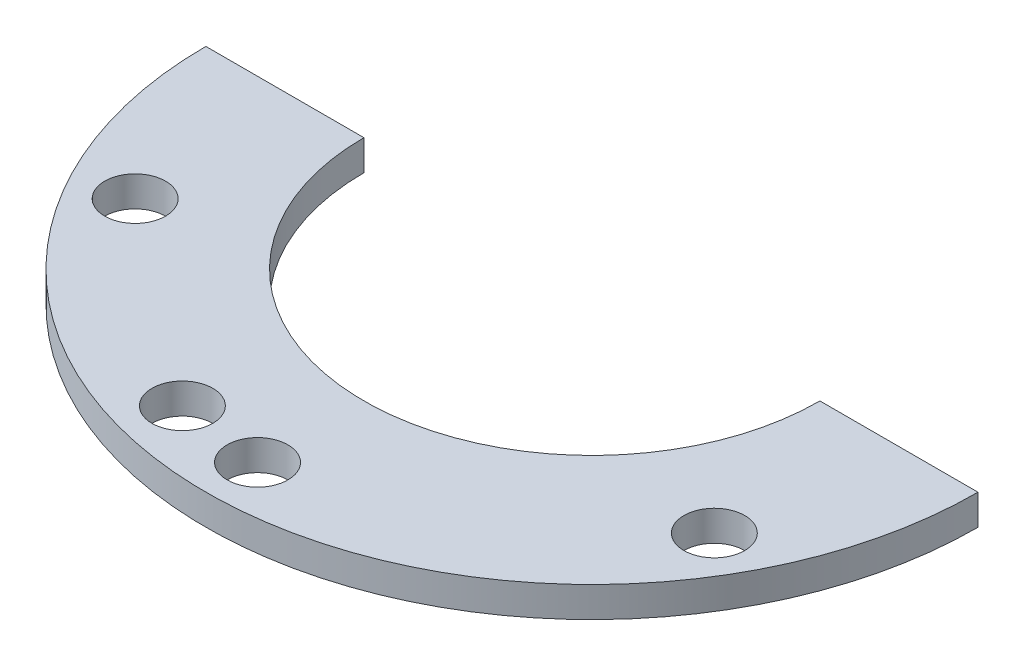
from build123d import *

# Parameters (mm, degrees)
SKETCH1_R               = 12.7
BOSS_EXTRUDE1_DEPTH     = 1
CUT_EXTRUDE1_DEPTH      = 18.98832955
CUT_EXTRUDE1_DEPTH_BACK = 18.98832955
SKETCH19_R              = 1
CUT_EXTRUDE2_DEPTH      = 18.98832955
CUT_EXTRUDE2_DEPTH_BACK = 18.98832955
SKETCH20_R              = 7.5
SKETCH21_W              = 65.874202484
SKETCH21_H              = 51.979273979
CUT_EXTRUDE3_DEPTH      = 18.98832955
CUT_EXTRUDE4_DEPTH      = 18.98832955
CUT_EXTRUDE4_DEPTH_BACK = 18.98832955
SKETCH23_R              = 1


with BuildPart() as part:
    # Sketch1 → Boss-Extrude1 (new body)
    with BuildSketch(Plane(origin=(0, 0, 0), x_dir=(1, 0, 0), z_dir=(0, 1, 0))):
        Circle(SKETCH1_R)
    extrude(amount=BOSS_EXTRUDE1_DEPTH)

    # Sketch19 → Cut-Extrude1 (cut, two sides: drawn at the far end of the back side and taken through both)
    with BuildSketch(Plane(origin=(0, 1, 0), x_dir=(1, 0, 0), z_dir=(0, 1, 0)).offset(-CUT_EXTRUDE1_DEPTH_BACK)):
        with Locations((0, 11)):
            Circle(SKETCH19_R)
        with Locations((9.526279442, 5.5)):
            Circle(SKETCH19_R)
        with Locations((9.526279442, -5.5)):
            Circle(SKETCH19_R)
        with Locations((0, -11)):
            Circle(SKETCH19_R)
        with Locations((-9.526279442, -5.5)):
            Circle(SKETCH19_R)
        with Locations((-9.526279442, 5.5)):
            Circle(SKETCH19_R)
    extrude(amount=CUT_EXTRUDE1_DEPTH + CUT_EXTRUDE1_DEPTH_BACK, mode=Mode.SUBTRACT)

    # Sketch20 → Cut-Extrude2 (cut, two sides: drawn at the far end of the back side and taken through both)
    with BuildSketch(Plane(origin=(0, 1, 0), x_dir=(1, 0, 0), z_dir=(0, 1, 0)).offset(-CUT_EXTRUDE2_DEPTH_BACK)):
        Circle(SKETCH20_R)
    extrude(amount=CUT_EXTRUDE2_DEPTH + CUT_EXTRUDE2_DEPTH_BACK, mode=Mode.SUBTRACT)

    # Sketch21 → Cut-Extrude3 (cut, through all)
    with BuildSketch(Plane.XY):
        with Locations((-3.816154381, 6.321647006)):
            Rectangle(SKETCH21_W, SKETCH21_H)
    extrude(amount=-CUT_EXTRUDE3_DEPTH, mode=Mode.SUBTRACT)

    # Sketch23 → Cut-Extrude4 (cut, two sides: drawn at the far end of the back side and taken through both)
    with BuildSketch(Plane(origin=(0, 1, 0), x_dir=(1, 0, 0), z_dir=(0, 1, 0)).offset(-CUT_EXTRUDE4_DEPTH_BACK)):
        with Locations((-2.847009496, -10.625184089)):
            Circle(SKETCH23_R)
    extrude(amount=CUT_EXTRUDE4_DEPTH + CUT_EXTRUDE4_DEPTH_BACK, mode=Mode.SUBTRACT)


solid = part.part
